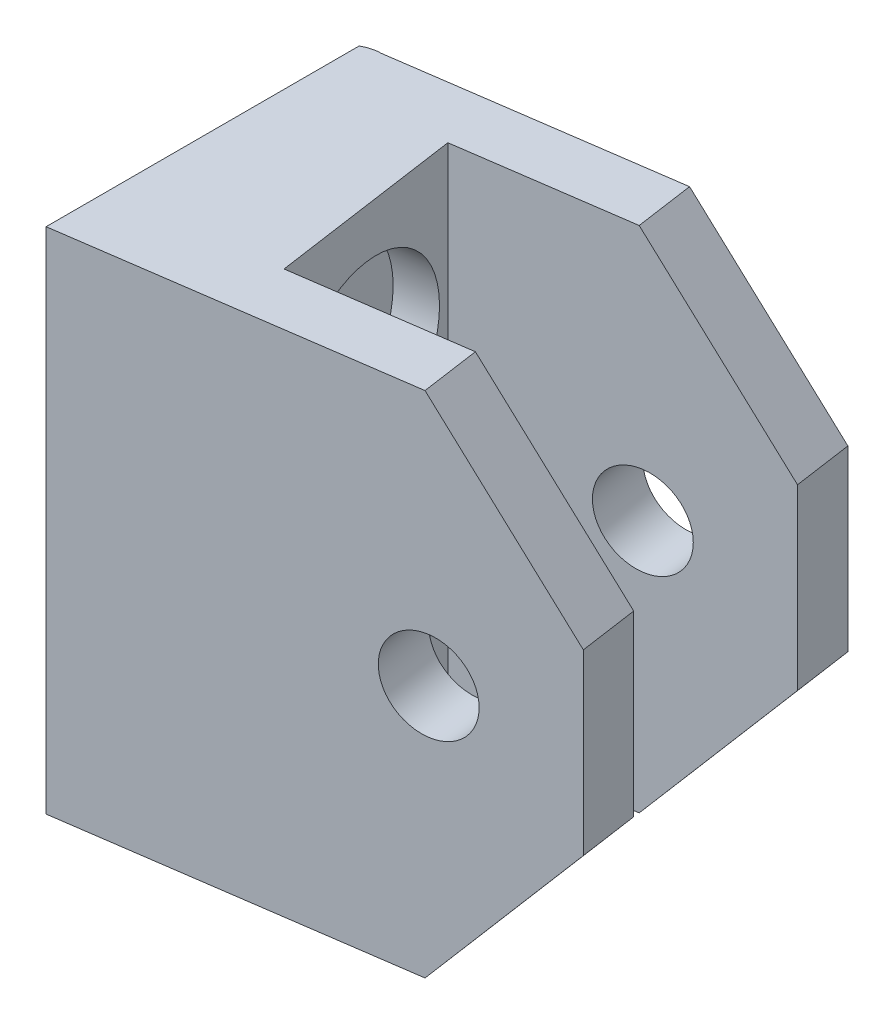
from build123d import *

# Parameters (mm, degrees)
BOSS_EXTRUDE1_DEPTH                     = 54.37886
SKETCH6_R                               = 4.7625
CUT_EXTRUDE2_DEPTH                      = 80.985513879
CBORE_FOR_M6_HEX_HEAD_BOLT1_D           = 6.6
CBORE_FOR_M6_HEX_HEAD_BOLT1_CBORE_D     = 18.55
CBORE_FOR_M6_HEX_HEAD_BOLT1_CBORE_DEPTH = 4.38


with BuildPart() as part:
    # Sketch1 → Boss-Extrude1 (new body)
    with BuildSketch(Plane(origin=(0, 0, 0), x_dir=(1, 0, 0), z_dir=(0, 1, 0))):
        with BuildLine():
            Line((43.576744561, 6.252203323), (0, 0))
            ThreePointArc((0, 0), (-0.986664618, -0.130963569), (-1.905, -0.514784687))
            Line((-1.905, -0.514784687), (-1.905, -33.845088532))
            Line((-1.905, -33.845088532), (-1.905, -33.965034078))
            Line((-1.905, -33.965034078), (-0.021561819, -33.694806493))
            Line((-0.021561819, -33.694806493), (48.313185262, -26.759945494))
            Line((48.313185262, -26.759945494), (47.411349637, -20.474311675))
            Line((47.411349637, -20.474311675), (14.726053779, -25.163856923))
            Line((14.726053779, -25.163856923), (11.793284327, -4.722975744))
            Line((11.793284327, -4.722975744), (44.478580186, -0.033430496))
            Line((44.478580186, -0.033430496), (43.576744561, 6.252203323))
        make_face()
    extrude(amount=BOSS_EXTRUDE1_DEPTH)

    # Sketch6 → Cut-Extrude2 (cut, through all)
    with BuildSketch(Plane(origin=(4.7364407, 0, 33.012148817), x_dir=(0.9898635935387781, 0, -0.1420213582053662), z_dir=(0.1420213582053662, 0, 0.9898635935387781))):
        with Locations((29.417979374, 27.18943)):
            Circle(SKETCH6_R)
        Polygon((44.022979374, 36.71443), (29.071940537, 54.37886), (44.022979374, 54.37886), align=None)
        Polygon((44.022979374, 0), (44.022979374, 17.66443), (29.071940537, 0), align=None)
    extrude(amount=-CUT_EXTRUDE2_DEPTH, mode=Mode.SUBTRACT)

    # CBORE for M6 Hex Head Bolt1 (through all)
    with Locations(Plane(origin=(10.891448703, 0, -1.562658075), x_dir=(-0.14202135820537037, 0, -0.9898635935387774), z_dir=(0.9898635935387774, 0, -0.14202135820537037))):
        with Locations((-16.6751, 39.88943), (-16.6751, 14.48943)):
            CounterBoreHole(CBORE_FOR_M6_HEX_HEAD_BOLT1_D / 2, CBORE_FOR_M6_HEX_HEAD_BOLT1_CBORE_D / 2, CBORE_FOR_M6_HEX_HEAD_BOLT1_CBORE_DEPTH)


solid = part.part
